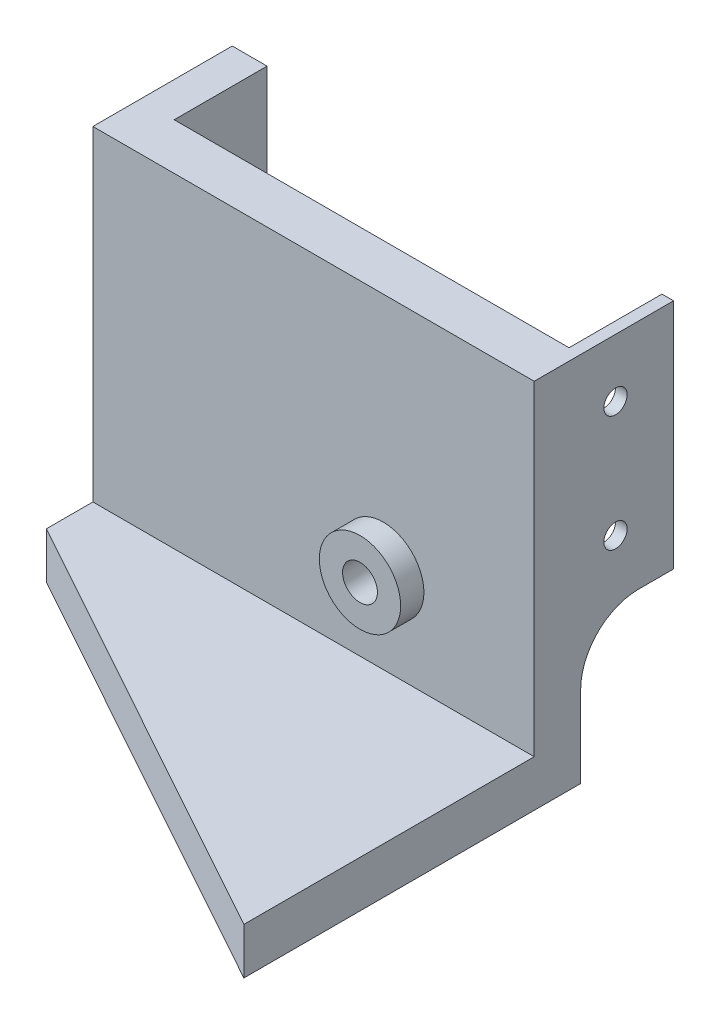
from build123d import *

# Parameters (mm, degrees)
BOSS_EXTRUDE1_DEPTH     = 20
SKETCH2_W               = 38
SKETCH2_H               = 4
BOSS_EXTRUDE2_DEPTH     = 12
FILLET1_R               = 5
SKETCH3_W               = 38
SKETCH3_H               = 4
BOSS_EXTRUDE3_DEPTH     = 25
SKETCH4_R               = 3.5
SKETCH4_R_2             = 1.5
BOSS_EXTRUDE4_DEPTH     = 2
SKETCH5_R               = 1.5
CUT_EXTRUDE1_DEPTH      = 49.713447835
CUT_EXTRUDE2_DEPTH      = 10
CUT_EXTRUDE3_DEPTH      = 50.689032995
CUT_EXTRUDE3_DEPTH_BACK = 50.689032995
SKETCH8_R               = 1


with BuildPart() as part:
    # Sketch1 → Boss-Extrude1 (new body)
    with BuildSketch(Plane(origin=(0, 0, 0), x_dir=(1, 0, 0), z_dir=(0, 1, 0))):
        Polygon((0, 12), (0, 0), (38, 0), (38, 12), (37, 12), (37, 4), (3, 4), (3, 12), align=None)
    extrude(amount=BOSS_EXTRUDE1_DEPTH)

    # Sketch2 → Boss-Extrude2 (add)
    with BuildSketch(Plane.XZ):
        with Locations((19, -2)):
            Rectangle(SKETCH2_W, SKETCH2_H)
    extrude(amount=BOSS_EXTRUDE2_DEPTH)

    # Fillet1
    fillet1_edges = [part.edges().sort_by_distance(p)[0] for p in [
        (1.5, 0, -4),
        (37.5, 0, -4),
    ]]
    fillet(fillet1_edges, radius=FILLET1_R)

    # Sketch3 → Boss-Extrude3 (add)
    with BuildSketch(Plane.XY):
        with Locations((19, -10)):
            Rectangle(SKETCH3_W, SKETCH3_H)
    extrude(amount=BOSS_EXTRUDE3_DEPTH)

    # Sketch4 → Boss-Extrude4 (add)
    with BuildSketch(Plane.XY):
        with Locations((25, -0.5)):
            Circle(SKETCH4_R)
        with Locations((25, -0.5)):
            Circle(SKETCH4_R_2, mode=Mode.SUBTRACT)
    extrude(amount=BOSS_EXTRUDE4_DEPTH)

    # Sketch5 → Cut-Extrude1 (cut, through all)
    with BuildSketch(Plane.XY.offset(2)):
        with Locations((25, -0.5)):
            Circle(SKETCH5_R)
    extrude(amount=-CUT_EXTRUDE1_DEPTH, mode=Mode.SUBTRACT)

    # Sketch6 → Cut-Extrude2 (cut)
    with BuildSketch(Plane(origin=(0, -8, 0), x_dir=(1, 0, 0), z_dir=(0, 1, 0))):
        Polygon((38, -25), (0, -4), (0, -25), align=None)
    extrude(amount=-CUT_EXTRUDE2_DEPTH, mode=Mode.SUBTRACT)

    # Sketch8 → Cut-Extrude3 (cut, two sides: drawn at the far end of the back side and taken through both)
    with BuildSketch(Plane(origin=(38, 0, 0), x_dir=(0, 0, -1), z_dir=(1, 0, 0)).offset(-CUT_EXTRUDE3_DEPTH_BACK)):
        with Locations((7, 15)):
            Circle(SKETCH8_R)
        with Locations((7, 5)):
            Circle(SKETCH8_R)
    extrude(amount=CUT_EXTRUDE3_DEPTH + CUT_EXTRUDE3_DEPTH_BACK, mode=Mode.SUBTRACT)


solid = part.part
